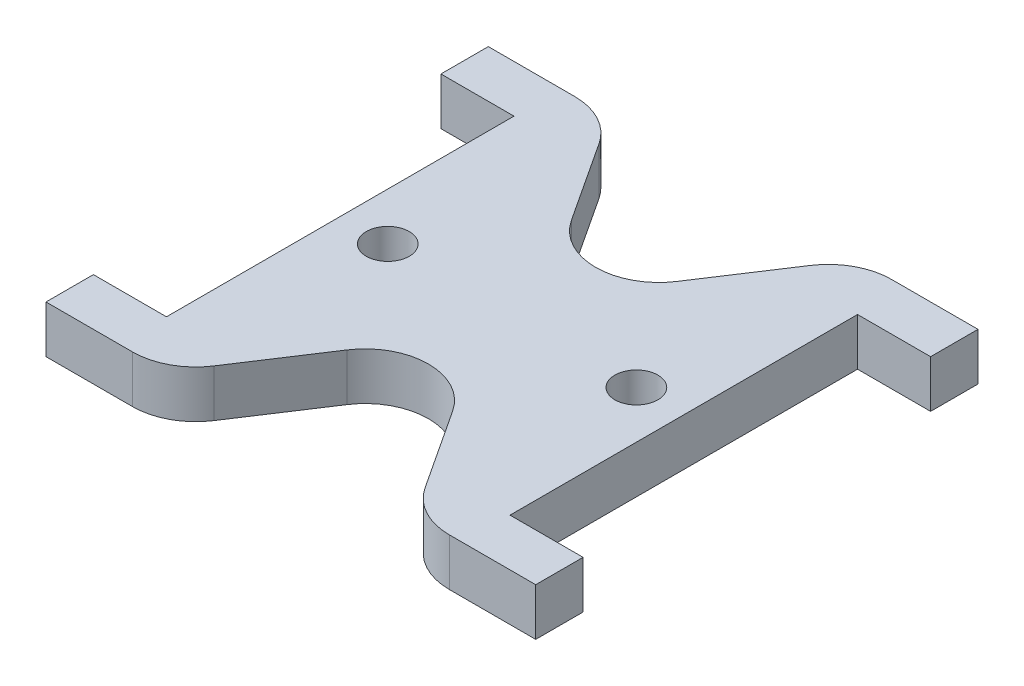
from build123d import *

# Parameters (mm, degrees)
SKETCH2_R           = 1.7272
BOSS_EXTRUDE1_DEPTH = 3.81
FILLET1_R           = 5.08


with BuildPart() as part:
    # Sketch2 → Boss-Extrude1 (new body)
    with BuildSketch(Plane.XZ.offset(32.657932219)):
        Polygon((10.109157694, -15.832760328), (13.919157694, -15.832760328), (19.794157694, -15.832760328), (19.794157694, -12.022760328), (13.919157694, -12.022760328), (13.919157694, 15.917239672), (19.794157694, 15.917239672), (19.794157694, 19.727239672), (13.919157694, 19.727239672), (10.109157694, 19.727239672), (0.109157694, 4.487239672), (-9.879450107, 19.727239672), (-13.700842306, 19.727239672), (-19.575842306, 19.727239672), (-19.575842306, 15.917239672), (-13.700842306, 15.917239672), (-13.700842306, -12.022760328), (-19.575842306, -12.022760328), (-19.575842306, -15.832760328), (-13.700842306, -15.832760328), (-9.879450107, -15.832760328), (0.109157694, -0.592760328), align=None)
        with Locations((-9.879450107, 1.947239672)):
            Circle(SKETCH2_R, mode=Mode.SUBTRACT)
        with Locations((10.109157694, 1.947239672)):
            Circle(SKETCH2_R, mode=Mode.SUBTRACT)
    extrude(amount=BOSS_EXTRUDE1_DEPTH)

    # Fillet1
    fillet1_edges = [part.edges().sort_by_distance(p)[0] for p in [
        (10.109157694, -34.562932219, -15.832760328),
        (-9.879450107, -34.562932219, -15.832760328),
        (10.109157694, -34.562932219, 19.727239672),
        (-9.879450107, -34.562932219, 19.727239672),
        (0.109157694, -34.562932219, 4.487239672),
        (0.109157694, -34.562932219, -0.592760328),
    ]]
    fillet(fillet1_edges, radius=FILLET1_R)


solid = part.part
